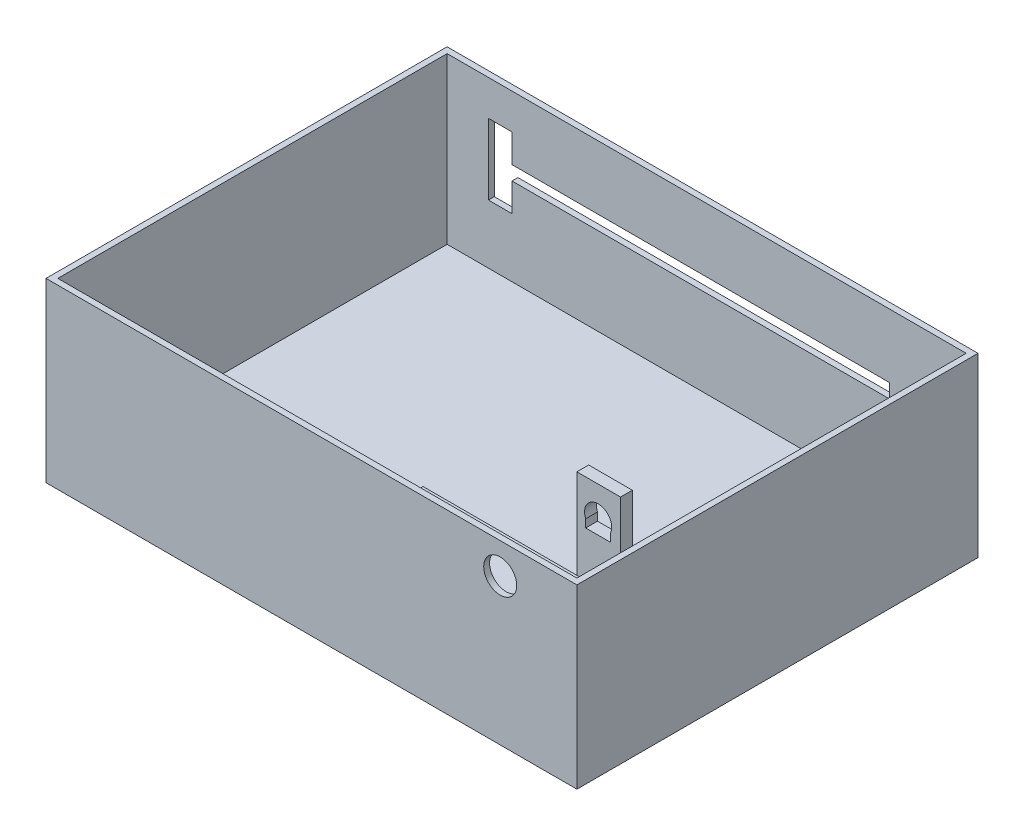
from build123d import *

# Parameters (mm, degrees)
SKETCH1_W                = 225
SKETCH1_H                = 170
BOSS_EXTRUDE1_DEPTH      = 75
SKETCH2_W                = 220
SKETCH2_H                = 165
CUT_EXTRUDE1_DEPTH       = 70
CUT_EXTRUDE2_DEPTH       = 10
SKETCH6_W                = 72
SKETCH6_H                = 22
BOSS_EXTRUDE2_DEPTH      = 49
SKETCH8_R                = 7
CUT_EXTRUDE3_DEPTH       = 25
SKETCH6_4_W              = 5
SKETCH6_4_H              = 5
BOSS_EXTRUDE4_DEPTH      = 70
BOSS_EXTRUDE5_DEPTH      = 40
BOSS_EXTRUDE5_DEPTH_BACK = 1
BOSS_EXTRUDE5_START      = 30
SKETCH11_W               = 8.5
SKETCH11_H               = 5
CUT_EXTRUDE4_DEPTH       = 10
CUT_EXTRUDE5_START       = -2.5
SKETCH13_W               = 67
SKETCH13_H               = 17
CUT_EXTRUDE5_DEPTH       = 42.5
FILLET1_R                = 17


with BuildPart() as part:
    # Sketch1 → Boss-Extrude1 (new body)
    with BuildSketch(Plane(origin=(0, 0, 0), x_dir=(1, 0, 0), z_dir=(0, 1, 0))):
        Rectangle(SKETCH1_W, SKETCH1_H)
    extrude(amount=BOSS_EXTRUDE1_DEPTH)

    # Sketch2 → Cut-Extrude1 (cut)
    with BuildSketch(Plane(origin=(0, 75, 0), x_dir=(1, 0, 0), z_dir=(0, 1, 0))):
        Rectangle(SKETCH2_W, SKETCH2_H)
    extrude(amount=-CUT_EXTRUDE1_DEPTH, mode=Mode.SUBTRACT)

    # Sketch5 → Cut-Extrude2 (cut)
    with BuildSketch(Plane(origin=(0, 0, -85), x_dir=(-1, 0, 0), z_dir=(0, 0, -1))):
        Polygon((92.5, 60), (92.5, 30), (82.5, 30), (82.5, 42), (-77.5, 42), (-77.5, 48), (82.5, 48), (82.5, 60), align=None)
    extrude(amount=-CUT_EXTRUDE2_DEPTH, mode=Mode.SUBTRACT)

    # Sketch6 → Boss-Extrude2 (add)
    with BuildSketch(Plane(origin=(0, 5, 0), x_dir=(1, 0, 0), z_dir=(0, 1, 0))):
        with Locations((58.810452566, -71.5)):
            Rectangle(SKETCH6_W, SKETCH6_H)
    extrude(amount=BOSS_EXTRUDE2_DEPTH)

    # Sketch8 → Cut-Extrude3 (cut)
    with BuildSketch(Plane(origin=(0, 0, 82.5), x_dir=(-1, 0, 0), z_dir=(0, 0, -1))):
        with Locations((-80, 62)):
            Circle(SKETCH8_R)
    extrude(amount=-CUT_EXTRUDE3_DEPTH, mode=Mode.SUBTRACT)

    # Sketch6<4> → Boss-Extrude4 (add)
    with BuildSketch(Plane(origin=(0, 5, 0), x_dir=(1, 0, 0), z_dir=(0, 1, 0))):
        with Locations((73.5, -41)):
            Rectangle(SKETCH6_4_W, SKETCH6_4_H)
        with Locations((87, -41)):
            Rectangle(SKETCH6_4_W, SKETCH6_4_H)
    extrude(amount=BOSS_EXTRUDE4_DEPTH)

    # Sketch11 → Boss-Extrude5 (add, two sides: drawn at the far end of the back side and taken through both)
    with BuildSketch(Plane(origin=(0, 5, 0), x_dir=(1, 0, 0), z_dir=(0, 1, 0)).offset(BOSS_EXTRUDE5_START - BOSS_EXTRUDE5_DEPTH_BACK)):
        with Locations((80.25, -41)):
            Rectangle(SKETCH11_W, SKETCH11_H)
    extrude(amount=BOSS_EXTRUDE5_DEPTH + BOSS_EXTRUDE5_DEPTH_BACK)

    # Sketch12 → Cut-Extrude4 (cut)
    with BuildSketch(Plane.XY.offset(43.5)):
        with BuildLine():
            Line((74.75, 59.65479212), (74.75, 56.25))
            Line((74.75, 56.25), (85.25, 56.25))
            Line((85.25, 56.25), (85.25, 59.65479212))
            ThreePointArc((85.25, 59.65479212), (80, 67.75), (74.75, 59.65479212))
        make_face()
    extrude(amount=-CUT_EXTRUDE4_DEPTH, mode=Mode.SUBTRACT)

    # Sketch13 → Cut-Extrude5 (cut)
    with BuildSketch(Plane(origin=(0, 54, 0), x_dir=(1, 0, 0), z_dir=(0, 1, 0)).offset(CUT_EXTRUDE5_START)):
        with Locations((58.810452566, -71.5)):
            Rectangle(SKETCH13_W, SKETCH13_H)
    extrude(amount=-CUT_EXTRUDE5_DEPTH, mode=Mode.SUBTRACT)

    # Fillet1
    # the kernel refuses this fillet: 17 mm, written as the material it adds along each edge
    with BuildSketch(Plane(origin=(84.5, 5, 38.5), x_dir=(-1, 0, 0), z_dir=(0, 0, 1)), Plane(origin=(89.5, 5, 38.5), x_dir=(0, 0, -1), z_dir=(-1, 0, 0)), Plane(origin=(71, 5, 43.5), x_dir=(0, 0, 1), z_dir=(1, 0, 0)), Plane(origin=(76, 5, 43.5), x_dir=(1, 0, 0), z_dir=(0, 0, -1)), Plane(origin=(71, 5, 38.5), x_dir=(-1, 0, 0), z_dir=(0, 0, 1)), Plane(origin=(76, 5, 38.5), x_dir=(0, 0, -1), z_dir=(-1, 0, 0)), Plane(origin=(84.5, 5, 43.5), x_dir=(0, 0, 1), z_dir=(1, 0, 0)), Plane(origin=(89.5, 5, 43.5), x_dir=(1, 0, 0), z_dir=(0, 0, -1))) as fillet1_piece_1:
        with BuildLine():
            CenterArc((FILLET1_R, -FILLET1_R), FILLET1_R, 90, 90)
            Line((0, -FILLET1_R), (-FILLET1_R * 0.02, -FILLET1_R))
            Line((-FILLET1_R * 0.02, -FILLET1_R), (-FILLET1_R * 0.02, FILLET1_R * 0.02))
            Line((-FILLET1_R * 0.02, FILLET1_R * 0.02), (FILLET1_R, FILLET1_R * 0.02))
            Line((FILLET1_R, FILLET1_R * 0.02), (FILLET1_R, 0))
        make_face()
    extrude(amount=5)
    with BuildSketch(Plane(origin=(84.5, 5, -4), x_dir=(-1, 0, 0), z_dir=(0, 0, 1))) as fillet1_piece_2a_section:
        with BuildLine():
            CenterArc((FILLET1_R, -FILLET1_R), FILLET1_R, 90, 90)
            Line((0, -FILLET1_R), (-FILLET1_R * 0.02, -FILLET1_R))
            Line((-FILLET1_R * 0.02, -FILLET1_R), (-FILLET1_R * 0.02, FILLET1_R * 0.02))
            Line((-FILLET1_R * 0.02, FILLET1_R * 0.02), (FILLET1_R, FILLET1_R * 0.02))
            Line((FILLET1_R, FILLET1_R * 0.02), (FILLET1_R, 0))
        make_face()
    fillet1_piece_2a = extrude(amount=47.5, mode=Mode.PRIVATE)
    fillet1_piece_2a = split(fillet1_piece_2a, bisect_by=Plane(origin=(80.651283057, 8.848716943, 38.5), z_dir=(0, 0, -1)), keep=Keep.TOP, mode=Mode.PRIVATE)
    with BuildSketch(Plane(origin=(89.5, 5, 38.5), x_dir=(0, 0, -1), z_dir=(-1, 0, 0))) as fillet1_piece_2b_section:
        with BuildLine():
            CenterArc((FILLET1_R, -FILLET1_R), FILLET1_R, 90, 90)
            Line((0, -FILLET1_R), (-FILLET1_R * 0.02, -FILLET1_R))
            Line((-FILLET1_R * 0.02, -FILLET1_R), (-FILLET1_R * 0.02, FILLET1_R * 0.02))
            Line((-FILLET1_R * 0.02, FILLET1_R * 0.02), (FILLET1_R, FILLET1_R * 0.02))
            Line((FILLET1_R, FILLET1_R * 0.02), (FILLET1_R, 0))
        make_face()
    fillet1_piece_2b = extrude(amount=47.5, mode=Mode.PRIVATE)
    fillet1_piece_2b = split(fillet1_piece_2b, bisect_by=Plane(origin=(84.5, 8.848716943, 34.651283057), z_dir=(-1, 0, 0)), keep=Keep.TOP, mode=Mode.PRIVATE)
    fillet1_piece_2 = fillet1_piece_2a & fillet1_piece_2b
    add(fillet1_piece_2)
    with BuildSketch(Plane(origin=(84.5, 5, 38.5), x_dir=(-1, 0, 0), z_dir=(0, 0, 1))) as fillet1_piece_3a_section:
        with BuildLine():
            CenterArc((FILLET1_R, -FILLET1_R), FILLET1_R, 90, 90)
            Line((0, -FILLET1_R), (-FILLET1_R * 0.02, -FILLET1_R))
            Line((-FILLET1_R * 0.02, -FILLET1_R), (-FILLET1_R * 0.02, FILLET1_R * 0.02))
            Line((-FILLET1_R * 0.02, FILLET1_R * 0.02), (FILLET1_R, FILLET1_R * 0.02))
            Line((FILLET1_R, FILLET1_R * 0.02), (FILLET1_R, 0))
        make_face()
    fillet1_piece_3a = extrude(amount=47.5, mode=Mode.PRIVATE)
    fillet1_piece_3a = split(fillet1_piece_3a, bisect_by=Plane(origin=(80.651283057, 8.848716943, 43.5), z_dir=(0, 0, 1)), keep=Keep.TOP, mode=Mode.PRIVATE)
    with BuildSketch(Plane(origin=(42, 5, 43.5), x_dir=(0, 0, 1), z_dir=(1, 0, 0))) as fillet1_piece_3b_section:
        with BuildLine():
            CenterArc((FILLET1_R, -FILLET1_R), FILLET1_R, 90, 90)
            Line((0, -FILLET1_R), (-FILLET1_R * 0.02, -FILLET1_R))
            Line((-FILLET1_R * 0.02, -FILLET1_R), (-FILLET1_R * 0.02, FILLET1_R * 0.02))
            Line((-FILLET1_R * 0.02, FILLET1_R * 0.02), (FILLET1_R, FILLET1_R * 0.02))
            Line((FILLET1_R, FILLET1_R * 0.02), (FILLET1_R, 0))
        make_face()
    fillet1_piece_3b = extrude(amount=47.5, mode=Mode.PRIVATE)
    fillet1_piece_3b = split(fillet1_piece_3b, bisect_by=Plane(origin=(84.5, 8.848716943, 47.348716943), z_dir=(-1, 0, 0)), keep=Keep.TOP, mode=Mode.PRIVATE)
    fillet1_piece_3 = fillet1_piece_3a & fillet1_piece_3b
    add(fillet1_piece_3)
    with BuildSketch(Plane(origin=(132, 5, 38.5), x_dir=(0, 0, -1), z_dir=(-1, 0, 0))) as fillet1_piece_4a_section:
        with BuildLine():
            CenterArc((FILLET1_R, -FILLET1_R), FILLET1_R, 90, 90)
            Line((0, -FILLET1_R), (-FILLET1_R * 0.02, -FILLET1_R))
            Line((-FILLET1_R * 0.02, -FILLET1_R), (-FILLET1_R * 0.02, FILLET1_R * 0.02))
            Line((-FILLET1_R * 0.02, FILLET1_R * 0.02), (FILLET1_R, FILLET1_R * 0.02))
            Line((FILLET1_R, FILLET1_R * 0.02), (FILLET1_R, 0))
        make_face()
    fillet1_piece_4a = extrude(amount=47.5, mode=Mode.PRIVATE)
    fillet1_piece_4a = split(fillet1_piece_4a, bisect_by=Plane(origin=(89.5, 8.848716943, 34.651283057), z_dir=(1, 0, 0)), keep=Keep.TOP, mode=Mode.PRIVATE)
    with BuildSketch(Plane(origin=(89.5, 5, 43.5), x_dir=(1, 0, 0), z_dir=(0, 0, -1))) as fillet1_piece_4b_section:
        with BuildLine():
            CenterArc((FILLET1_R, -FILLET1_R), FILLET1_R, 90, 90)
            Line((0, -FILLET1_R), (-FILLET1_R * 0.02, -FILLET1_R))
            Line((-FILLET1_R * 0.02, -FILLET1_R), (-FILLET1_R * 0.02, FILLET1_R * 0.02))
            Line((-FILLET1_R * 0.02, FILLET1_R * 0.02), (FILLET1_R, FILLET1_R * 0.02))
            Line((FILLET1_R, FILLET1_R * 0.02), (FILLET1_R, 0))
        make_face()
    fillet1_piece_4b = extrude(amount=47.5, mode=Mode.PRIVATE)
    fillet1_piece_4b = split(fillet1_piece_4b, bisect_by=Plane(origin=(93.348716943, 8.848716943, 38.5), z_dir=(0, 0, -1)), keep=Keep.TOP, mode=Mode.PRIVATE)
    fillet1_piece_4 = fillet1_piece_4a & fillet1_piece_4b
    add(fillet1_piece_4)
    with BuildSketch(Plane(origin=(71, 5, 38.5), x_dir=(-1, 0, 0), z_dir=(0, 0, 1))) as fillet1_piece_5a_section:
        with BuildLine():
            CenterArc((FILLET1_R, -FILLET1_R), FILLET1_R, 90, 90)
            Line((0, -FILLET1_R), (-FILLET1_R * 0.02, -FILLET1_R))
            Line((-FILLET1_R * 0.02, -FILLET1_R), (-FILLET1_R * 0.02, FILLET1_R * 0.02))
            Line((-FILLET1_R * 0.02, FILLET1_R * 0.02), (FILLET1_R, FILLET1_R * 0.02))
            Line((FILLET1_R, FILLET1_R * 0.02), (FILLET1_R, 0))
        make_face()
    fillet1_piece_5a = extrude(amount=47.5, mode=Mode.PRIVATE)
    fillet1_piece_5a = split(fillet1_piece_5a, bisect_by=Plane(origin=(67.151283057, 8.848716943, 43.5), z_dir=(0, 0, 1)), keep=Keep.TOP, mode=Mode.PRIVATE)
    with BuildSketch(Plane(origin=(28.5, 5, 43.5), x_dir=(0, 0, 1), z_dir=(1, 0, 0))) as fillet1_piece_5b_section:
        with BuildLine():
            CenterArc((FILLET1_R, -FILLET1_R), FILLET1_R, 90, 90)
            Line((0, -FILLET1_R), (-FILLET1_R * 0.02, -FILLET1_R))
            Line((-FILLET1_R * 0.02, -FILLET1_R), (-FILLET1_R * 0.02, FILLET1_R * 0.02))
            Line((-FILLET1_R * 0.02, FILLET1_R * 0.02), (FILLET1_R, FILLET1_R * 0.02))
            Line((FILLET1_R, FILLET1_R * 0.02), (FILLET1_R, 0))
        make_face()
    fillet1_piece_5b = extrude(amount=47.5, mode=Mode.PRIVATE)
    fillet1_piece_5b = split(fillet1_piece_5b, bisect_by=Plane(origin=(71, 8.848716943, 47.348716943), z_dir=(-1, 0, 0)), keep=Keep.TOP, mode=Mode.PRIVATE)
    fillet1_piece_5 = fillet1_piece_5a & fillet1_piece_5b
    add(fillet1_piece_5)
    with BuildSketch(Plane(origin=(76, 5, 86), x_dir=(1, 0, 0), z_dir=(0, 0, -1))) as fillet1_piece_6a_section:
        with BuildLine():
            CenterArc((FILLET1_R, -FILLET1_R), FILLET1_R, 90, 90)
            Line((0, -FILLET1_R), (-FILLET1_R * 0.02, -FILLET1_R))
            Line((-FILLET1_R * 0.02, -FILLET1_R), (-FILLET1_R * 0.02, FILLET1_R * 0.02))
            Line((-FILLET1_R * 0.02, FILLET1_R * 0.02), (FILLET1_R, FILLET1_R * 0.02))
            Line((FILLET1_R, FILLET1_R * 0.02), (FILLET1_R, 0))
        make_face()
    fillet1_piece_6a = extrude(amount=47.5, mode=Mode.PRIVATE)
    fillet1_piece_6a = split(fillet1_piece_6a, bisect_by=Plane(origin=(79.848716943, 8.848716943, 43.5), z_dir=(0, 0, 1)), keep=Keep.TOP, mode=Mode.PRIVATE)
    with BuildSketch(Plane(origin=(71, 5, 43.5), x_dir=(0, 0, 1), z_dir=(1, 0, 0))) as fillet1_piece_6b_section:
        with BuildLine():
            CenterArc((FILLET1_R, -FILLET1_R), FILLET1_R, 90, 90)
            Line((0, -FILLET1_R), (-FILLET1_R * 0.02, -FILLET1_R))
            Line((-FILLET1_R * 0.02, -FILLET1_R), (-FILLET1_R * 0.02, FILLET1_R * 0.02))
            Line((-FILLET1_R * 0.02, FILLET1_R * 0.02), (FILLET1_R, FILLET1_R * 0.02))
            Line((FILLET1_R, FILLET1_R * 0.02), (FILLET1_R, 0))
        make_face()
    fillet1_piece_6b = extrude(amount=47.5, mode=Mode.PRIVATE)
    fillet1_piece_6b = split(fillet1_piece_6b, bisect_by=Plane(origin=(76, 8.848716943, 47.348716943), z_dir=(1, 0, 0)), keep=Keep.TOP, mode=Mode.PRIVATE)
    fillet1_piece_6 = fillet1_piece_6a & fillet1_piece_6b
    add(fillet1_piece_6)
    with BuildSketch(Plane(origin=(118.5, 5, 38.5), x_dir=(0, 0, -1), z_dir=(-1, 0, 0))) as fillet1_piece_7a_section:
        with BuildLine():
            CenterArc((FILLET1_R, -FILLET1_R), FILLET1_R, 90, 90)
            Line((0, -FILLET1_R), (-FILLET1_R * 0.02, -FILLET1_R))
            Line((-FILLET1_R * 0.02, -FILLET1_R), (-FILLET1_R * 0.02, FILLET1_R * 0.02))
            Line((-FILLET1_R * 0.02, FILLET1_R * 0.02), (FILLET1_R, FILLET1_R * 0.02))
            Line((FILLET1_R, FILLET1_R * 0.02), (FILLET1_R, 0))
        make_face()
    fillet1_piece_7a = extrude(amount=47.5, mode=Mode.PRIVATE)
    fillet1_piece_7a = split(fillet1_piece_7a, bisect_by=Plane(origin=(76, 8.848716943, 34.651283057), z_dir=(1, 0, 0)), keep=Keep.TOP, mode=Mode.PRIVATE)
    with BuildSketch(Plane(origin=(76, 5, 43.5), x_dir=(1, 0, 0), z_dir=(0, 0, -1))) as fillet1_piece_7b_section:
        with BuildLine():
            CenterArc((FILLET1_R, -FILLET1_R), FILLET1_R, 90, 90)
            Line((0, -FILLET1_R), (-FILLET1_R * 0.02, -FILLET1_R))
            Line((-FILLET1_R * 0.02, -FILLET1_R), (-FILLET1_R * 0.02, FILLET1_R * 0.02))
            Line((-FILLET1_R * 0.02, FILLET1_R * 0.02), (FILLET1_R, FILLET1_R * 0.02))
            Line((FILLET1_R, FILLET1_R * 0.02), (FILLET1_R, 0))
        make_face()
    fillet1_piece_7b = extrude(amount=47.5, mode=Mode.PRIVATE)
    fillet1_piece_7b = split(fillet1_piece_7b, bisect_by=Plane(origin=(79.848716943, 8.848716943, 38.5), z_dir=(0, 0, -1)), keep=Keep.TOP, mode=Mode.PRIVATE)
    fillet1_piece_7 = fillet1_piece_7a & fillet1_piece_7b
    add(fillet1_piece_7)
    with BuildSketch(Plane(origin=(71, 5, -4), x_dir=(-1, 0, 0), z_dir=(0, 0, 1))) as fillet1_piece_8a_section:
        with BuildLine():
            CenterArc((FILLET1_R, -FILLET1_R), FILLET1_R, 90, 90)
            Line((0, -FILLET1_R), (-FILLET1_R * 0.02, -FILLET1_R))
            Line((-FILLET1_R * 0.02, -FILLET1_R), (-FILLET1_R * 0.02, FILLET1_R * 0.02))
            Line((-FILLET1_R * 0.02, FILLET1_R * 0.02), (FILLET1_R, FILLET1_R * 0.02))
            Line((FILLET1_R, FILLET1_R * 0.02), (FILLET1_R, 0))
        make_face()
    fillet1_piece_8a = extrude(amount=47.5, mode=Mode.PRIVATE)
    fillet1_piece_8a = split(fillet1_piece_8a, bisect_by=Plane(origin=(67.151283057, 8.848716943, 38.5), z_dir=(0, 0, -1)), keep=Keep.TOP, mode=Mode.PRIVATE)
    with BuildSketch(Plane(origin=(76, 5, 38.5), x_dir=(0, 0, -1), z_dir=(-1, 0, 0))) as fillet1_piece_8b_section:
        with BuildLine():
            CenterArc((FILLET1_R, -FILLET1_R), FILLET1_R, 90, 90)
            Line((0, -FILLET1_R), (-FILLET1_R * 0.02, -FILLET1_R))
            Line((-FILLET1_R * 0.02, -FILLET1_R), (-FILLET1_R * 0.02, FILLET1_R * 0.02))
            Line((-FILLET1_R * 0.02, FILLET1_R * 0.02), (FILLET1_R, FILLET1_R * 0.02))
            Line((FILLET1_R, FILLET1_R * 0.02), (FILLET1_R, 0))
        make_face()
    fillet1_piece_8b = extrude(amount=47.5, mode=Mode.PRIVATE)
    fillet1_piece_8b = split(fillet1_piece_8b, bisect_by=Plane(origin=(71, 8.848716943, 34.651283057), z_dir=(-1, 0, 0)), keep=Keep.TOP, mode=Mode.PRIVATE)
    fillet1_piece_8 = fillet1_piece_8a & fillet1_piece_8b
    add(fillet1_piece_8)
    with BuildSketch(Plane(origin=(89.5, 5, 86), x_dir=(1, 0, 0), z_dir=(0, 0, -1))) as fillet1_piece_9a_section:
        with BuildLine():
            CenterArc((FILLET1_R, -FILLET1_R), FILLET1_R, 90, 90)
            Line((0, -FILLET1_R), (-FILLET1_R * 0.02, -FILLET1_R))
            Line((-FILLET1_R * 0.02, -FILLET1_R), (-FILLET1_R * 0.02, FILLET1_R * 0.02))
            Line((-FILLET1_R * 0.02, FILLET1_R * 0.02), (FILLET1_R, FILLET1_R * 0.02))
            Line((FILLET1_R, FILLET1_R * 0.02), (FILLET1_R, 0))
        make_face()
    fillet1_piece_9a = extrude(amount=47.5, mode=Mode.PRIVATE)
    fillet1_piece_9a = split(fillet1_piece_9a, bisect_by=Plane(origin=(93.348716943, 8.848716943, 43.5), z_dir=(0, 0, 1)), keep=Keep.TOP, mode=Mode.PRIVATE)
    with BuildSketch(Plane(origin=(84.5, 5, 43.5), x_dir=(0, 0, 1), z_dir=(1, 0, 0))) as fillet1_piece_9b_section:
        with BuildLine():
            CenterArc((FILLET1_R, -FILLET1_R), FILLET1_R, 90, 90)
            Line((0, -FILLET1_R), (-FILLET1_R * 0.02, -FILLET1_R))
            Line((-FILLET1_R * 0.02, -FILLET1_R), (-FILLET1_R * 0.02, FILLET1_R * 0.02))
            Line((-FILLET1_R * 0.02, FILLET1_R * 0.02), (FILLET1_R, FILLET1_R * 0.02))
            Line((FILLET1_R, FILLET1_R * 0.02), (FILLET1_R, 0))
        make_face()
    fillet1_piece_9b = extrude(amount=47.5, mode=Mode.PRIVATE)
    fillet1_piece_9b = split(fillet1_piece_9b, bisect_by=Plane(origin=(89.5, 8.848716943, 47.348716943), z_dir=(1, 0, 0)), keep=Keep.TOP, mode=Mode.PRIVATE)
    fillet1_piece_9 = fillet1_piece_9a & fillet1_piece_9b
    add(fillet1_piece_9)


solid = part.part
